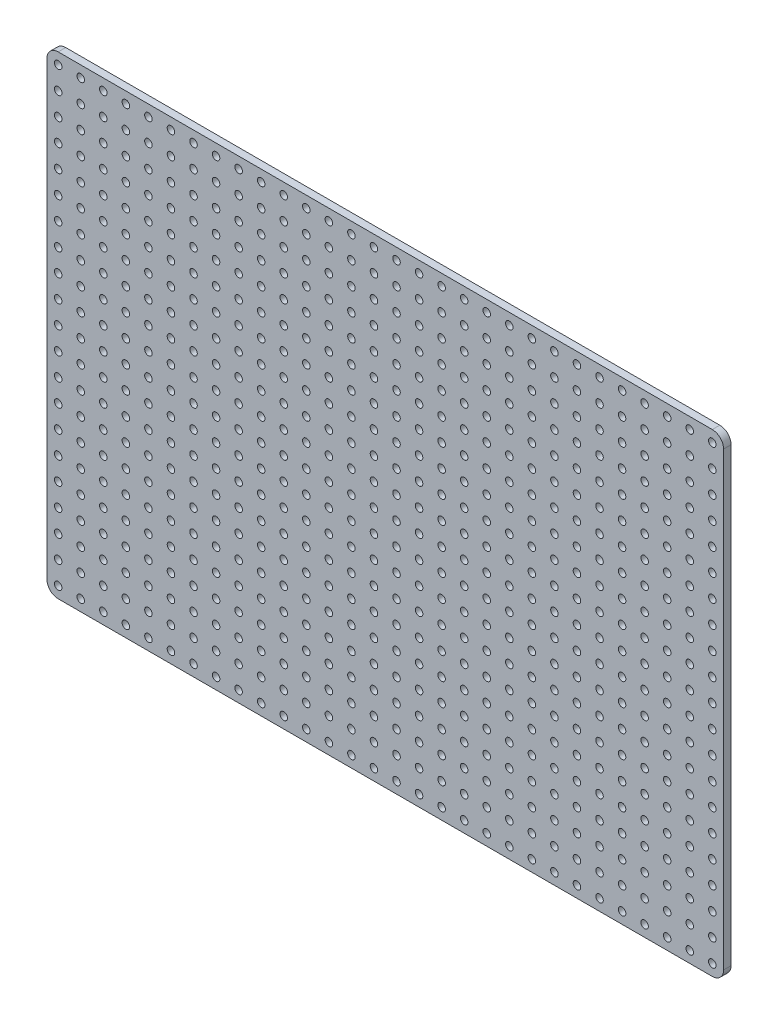
from build123d import *

# Parameters (mm, degrees)
MODEL_R                 = 1.5
SALIENTE_EXTRUIR1_DEPTH = 3


with BuildPart() as part:
    # Model → Saliente-Extruir1 (new body)
    with BuildSketch(Plane.XY):
        with BuildLine():
            Line((256.429131311, 489.742243614), (517.429131311, 489.742243614))
            ThreePointArc((517.429131311, 489.742243614), (520.611111826, 488.424224129), (521.929131311, 485.242243614))
            Line((521.929131311, 485.242243614), (521.929131311, 305.242243614))
            ThreePointArc((521.929131311, 305.242243614), (520.611111826, 302.060263099), (517.429131311, 300.742243614))
            Line((517.429131311, 300.742243614), (256.429131311, 300.742243614))
            ThreePointArc((256.429131311, 300.742243614), (253.247150795, 302.060263099), (251.929131311, 305.242243614))
            Line((251.929131311, 305.242243614), (251.929131311, 485.242243614))
            ThreePointArc((251.929131311, 485.242243614), (253.247150795, 488.424224129), (256.429131311, 489.742243614))
        make_face()
        with Locations((256.429131311, 485.242243614)):
            Circle(MODEL_R, mode=Mode.SUBTRACT)
        with Locations((256.429131311, 476.242243614)):
            Circle(MODEL_R, mode=Mode.SUBTRACT)
        with Locations((256.429131311, 467.242243614)):
            Circle(MODEL_R, mode=Mode.SUBTRACT)
        with Locations((256.429131311, 458.242243614)):
            Circle(MODEL_R, mode=Mode.SUBTRACT)
        with Locations((256.429131311, 449.242243614)):
            Circle(MODEL_R, mode=Mode.SUBTRACT)
        with Locations((256.429131311, 440.242243614)):
            Circle(MODEL_R, mode=Mode.SUBTRACT)
        with Locations((256.429131311, 431.242243614)):
            Circle(MODEL_R, mode=Mode.SUBTRACT)
        with Locations((256.429131311, 422.242243614)):
            Circle(MODEL_R, mode=Mode.SUBTRACT)
        with Locations((256.429131311, 413.242243614)):
            Circle(MODEL_R, mode=Mode.SUBTRACT)
        with Locations((256.429131311, 404.242243614)):
            Circle(MODEL_R, mode=Mode.SUBTRACT)
        with Locations((256.429131311, 395.242243614)):
            Circle(MODEL_R, mode=Mode.SUBTRACT)
        with Locations((256.429131311, 386.242243614)):
            Circle(MODEL_R, mode=Mode.SUBTRACT)
        with Locations((256.429131311, 377.242243614)):
            Circle(MODEL_R, mode=Mode.SUBTRACT)
        with Locations((256.429131311, 368.242243614)):
            Circle(MODEL_R, mode=Mode.SUBTRACT)
        with Locations((256.429131311, 359.242243614)):
            Circle(MODEL_R, mode=Mode.SUBTRACT)
        with Locations((256.429131311, 350.242243614)):
            Circle(MODEL_R, mode=Mode.SUBTRACT)
        with Locations((256.429131311, 341.242243614)):
            Circle(MODEL_R, mode=Mode.SUBTRACT)
        with Locations((256.429131311, 332.242243614)):
            Circle(MODEL_R, mode=Mode.SUBTRACT)
        with Locations((256.429131311, 323.242243614)):
            Circle(MODEL_R, mode=Mode.SUBTRACT)
        with Locations((256.429131311, 314.242243614)):
            Circle(MODEL_R, mode=Mode.SUBTRACT)
        with Locations((256.429131311, 305.242243614)):
            Circle(MODEL_R, mode=Mode.SUBTRACT)
        with Locations((265.429131311, 485.242243614)):
            Circle(MODEL_R, mode=Mode.SUBTRACT)
        with Locations((265.429131311, 476.242243614)):
            Circle(MODEL_R, mode=Mode.SUBTRACT)
        with Locations((265.429131311, 467.242243614)):
            Circle(MODEL_R, mode=Mode.SUBTRACT)
        with Locations((265.429131311, 458.242243614)):
            Circle(MODEL_R, mode=Mode.SUBTRACT)
        with Locations((265.429131311, 449.242243614)):
            Circle(MODEL_R, mode=Mode.SUBTRACT)
        with Locations((265.429131311, 440.242243614)):
            Circle(MODEL_R, mode=Mode.SUBTRACT)
        with Locations((265.429131311, 431.242243614)):
            Circle(MODEL_R, mode=Mode.SUBTRACT)
        with Locations((265.429131311, 422.242243614)):
            Circle(MODEL_R, mode=Mode.SUBTRACT)
        with Locations((265.429131311, 413.242243614)):
            Circle(MODEL_R, mode=Mode.SUBTRACT)
        with Locations((265.429131311, 404.242243614)):
            Circle(MODEL_R, mode=Mode.SUBTRACT)
        with Locations((265.429131311, 395.242243614)):
            Circle(MODEL_R, mode=Mode.SUBTRACT)
        with Locations((265.429131311, 386.242243614)):
            Circle(MODEL_R, mode=Mode.SUBTRACT)
        with Locations((265.429131311, 377.242243614)):
            Circle(MODEL_R, mode=Mode.SUBTRACT)
        with Locations((265.429131311, 368.242243614)):
            Circle(MODEL_R, mode=Mode.SUBTRACT)
        with Locations((265.429131311, 359.242243614)):
            Circle(MODEL_R, mode=Mode.SUBTRACT)
        with Locations((265.429131311, 350.242243614)):
            Circle(MODEL_R, mode=Mode.SUBTRACT)
        with Locations((265.429131311, 341.242243614)):
            Circle(MODEL_R, mode=Mode.SUBTRACT)
        with Locations((265.429131311, 332.242243614)):
            Circle(MODEL_R, mode=Mode.SUBTRACT)
        with Locations((265.429131311, 323.242243614)):
            Circle(MODEL_R, mode=Mode.SUBTRACT)
        with Locations((265.429131311, 314.242243614)):
            Circle(MODEL_R, mode=Mode.SUBTRACT)
        with Locations((265.429131311, 305.242243614)):
            Circle(MODEL_R, mode=Mode.SUBTRACT)
        with Locations((274.429131311, 485.242243614)):
            Circle(MODEL_R, mode=Mode.SUBTRACT)
        with Locations((274.429131311, 476.242243614)):
            Circle(MODEL_R, mode=Mode.SUBTRACT)
        with Locations((274.429131311, 467.242243614)):
            Circle(MODEL_R, mode=Mode.SUBTRACT)
        with Locations((274.429131311, 458.242243614)):
            Circle(MODEL_R, mode=Mode.SUBTRACT)
        with Locations((274.429131311, 449.242243614)):
            Circle(MODEL_R, mode=Mode.SUBTRACT)
        with Locations((274.429131311, 440.242243614)):
            Circle(MODEL_R, mode=Mode.SUBTRACT)
        with Locations((274.429131311, 431.242243614)):
            Circle(MODEL_R, mode=Mode.SUBTRACT)
        with Locations((274.429131311, 422.242243614)):
            Circle(MODEL_R, mode=Mode.SUBTRACT)
        with Locations((274.429131311, 413.242243614)):
            Circle(MODEL_R, mode=Mode.SUBTRACT)
        with Locations((274.429131311, 404.242243614)):
            Circle(MODEL_R, mode=Mode.SUBTRACT)
        with Locations((274.429131311, 395.242243614)):
            Circle(MODEL_R, mode=Mode.SUBTRACT)
        with Locations((274.429131311, 386.242243614)):
            Circle(MODEL_R, mode=Mode.SUBTRACT)
        with Locations((274.429131311, 377.242243614)):
            Circle(MODEL_R, mode=Mode.SUBTRACT)
        with Locations((274.429131311, 368.242243614)):
            Circle(MODEL_R, mode=Mode.SUBTRACT)
        with Locations((274.429131311, 359.242243614)):
            Circle(MODEL_R, mode=Mode.SUBTRACT)
        with Locations((274.429131311, 350.242243614)):
            Circle(MODEL_R, mode=Mode.SUBTRACT)
        with Locations((274.429131311, 341.242243614)):
            Circle(MODEL_R, mode=Mode.SUBTRACT)
        with Locations((274.429131311, 332.242243614)):
            Circle(MODEL_R, mode=Mode.SUBTRACT)
        with Locations((274.429131311, 323.242243614)):
            Circle(MODEL_R, mode=Mode.SUBTRACT)
        with Locations((274.429131311, 314.242243614)):
            Circle(MODEL_R, mode=Mode.SUBTRACT)
        with Locations((274.429131311, 305.242243614)):
            Circle(MODEL_R, mode=Mode.SUBTRACT)
        with Locations((283.429131311, 485.242243614)):
            Circle(MODEL_R, mode=Mode.SUBTRACT)
        with Locations((283.429131311, 476.242243614)):
            Circle(MODEL_R, mode=Mode.SUBTRACT)
        with Locations((283.429131311, 467.242243614)):
            Circle(MODEL_R, mode=Mode.SUBTRACT)
        with Locations((283.429131311, 458.242243614)):
            Circle(MODEL_R, mode=Mode.SUBTRACT)
        with Locations((283.429131311, 449.242243614)):
            Circle(MODEL_R, mode=Mode.SUBTRACT)
        with Locations((283.429131311, 440.242243614)):
            Circle(MODEL_R, mode=Mode.SUBTRACT)
        with Locations((283.429131311, 431.242243614)):
            Circle(MODEL_R, mode=Mode.SUBTRACT)
        with Locations((283.429131311, 422.242243614)):
            Circle(MODEL_R, mode=Mode.SUBTRACT)
        with Locations((283.429131311, 413.242243614)):
            Circle(MODEL_R, mode=Mode.SUBTRACT)
        with Locations((283.429131311, 404.242243614)):
            Circle(MODEL_R, mode=Mode.SUBTRACT)
        with Locations((283.429131311, 395.242243614)):
            Circle(MODEL_R, mode=Mode.SUBTRACT)
        with Locations((283.429131311, 386.242243614)):
            Circle(MODEL_R, mode=Mode.SUBTRACT)
        with Locations((283.429131311, 377.242243614)):
            Circle(MODEL_R, mode=Mode.SUBTRACT)
        with Locations((283.429131311, 368.242243614)):
            Circle(MODEL_R, mode=Mode.SUBTRACT)
        with Locations((283.429131311, 359.242243614)):
            Circle(MODEL_R, mode=Mode.SUBTRACT)
        with Locations((283.429131311, 350.242243614)):
            Circle(MODEL_R, mode=Mode.SUBTRACT)
        with Locations((283.429131311, 341.242243614)):
            Circle(MODEL_R, mode=Mode.SUBTRACT)
        with Locations((283.429131311, 332.242243614)):
            Circle(MODEL_R, mode=Mode.SUBTRACT)
        with Locations((283.429131311, 323.242243614)):
            Circle(MODEL_R, mode=Mode.SUBTRACT)
        with Locations((283.429131311, 314.242243614)):
            Circle(MODEL_R, mode=Mode.SUBTRACT)
        with Locations((283.429131311, 305.242243614)):
            Circle(MODEL_R, mode=Mode.SUBTRACT)
        with Locations((292.429131311, 485.242243614)):
            Circle(MODEL_R, mode=Mode.SUBTRACT)
        with Locations((292.429131311, 476.242243614)):
            Circle(MODEL_R, mode=Mode.SUBTRACT)
        with Locations((292.429131311, 467.242243614)):
            Circle(MODEL_R, mode=Mode.SUBTRACT)
        with Locations((292.429131311, 458.242243614)):
            Circle(MODEL_R, mode=Mode.SUBTRACT)
        with Locations((292.429131311, 449.242243614)):
            Circle(MODEL_R, mode=Mode.SUBTRACT)
        with Locations((292.429131311, 440.242243614)):
            Circle(MODEL_R, mode=Mode.SUBTRACT)
        with Locations((292.429131311, 431.242243614)):
            Circle(MODEL_R, mode=Mode.SUBTRACT)
        with Locations((292.429131311, 422.242243614)):
            Circle(MODEL_R, mode=Mode.SUBTRACT)
        with Locations((292.429131311, 413.242243614)):
            Circle(MODEL_R, mode=Mode.SUBTRACT)
        with Locations((292.429131311, 404.242243614)):
            Circle(MODEL_R, mode=Mode.SUBTRACT)
        with Locations((292.429131311, 395.242243614)):
            Circle(MODEL_R, mode=Mode.SUBTRACT)
        with Locations((292.429131311, 386.242243614)):
            Circle(MODEL_R, mode=Mode.SUBTRACT)
        with Locations((292.429131311, 377.242243614)):
            Circle(MODEL_R, mode=Mode.SUBTRACT)
        with Locations((292.429131311, 368.242243614)):
            Circle(MODEL_R, mode=Mode.SUBTRACT)
        with Locations((292.429131311, 359.242243614)):
            Circle(MODEL_R, mode=Mode.SUBTRACT)
        with Locations((292.429131311, 350.242243614)):
            Circle(MODEL_R, mode=Mode.SUBTRACT)
        with Locations((292.429131311, 341.242243614)):
            Circle(MODEL_R, mode=Mode.SUBTRACT)
        with Locations((292.429131311, 332.242243614)):
            Circle(MODEL_R, mode=Mode.SUBTRACT)
        with Locations((292.429131311, 323.242243614)):
            Circle(MODEL_R, mode=Mode.SUBTRACT)
        with Locations((292.429131311, 314.242243614)):
            Circle(MODEL_R, mode=Mode.SUBTRACT)
        with Locations((292.429131311, 305.242243614)):
            Circle(MODEL_R, mode=Mode.SUBTRACT)
        with Locations((301.429131311, 485.242243614)):
            Circle(MODEL_R, mode=Mode.SUBTRACT)
        with Locations((301.429131311, 476.242243614)):
            Circle(MODEL_R, mode=Mode.SUBTRACT)
        with Locations((301.429131311, 467.242243614)):
            Circle(MODEL_R, mode=Mode.SUBTRACT)
        with Locations((301.429131311, 458.242243614)):
            Circle(MODEL_R, mode=Mode.SUBTRACT)
        with Locations((301.429131311, 449.242243614)):
            Circle(MODEL_R, mode=Mode.SUBTRACT)
        with Locations((301.429131311, 440.242243614)):
            Circle(MODEL_R, mode=Mode.SUBTRACT)
        with Locations((301.429131311, 431.242243614)):
            Circle(MODEL_R, mode=Mode.SUBTRACT)
        with Locations((301.429131311, 422.242243614)):
            Circle(MODEL_R, mode=Mode.SUBTRACT)
        with Locations((301.429131311, 413.242243614)):
            Circle(MODEL_R, mode=Mode.SUBTRACT)
        with Locations((301.429131311, 404.242243614)):
            Circle(MODEL_R, mode=Mode.SUBTRACT)
        with Locations((301.429131311, 395.242243614)):
            Circle(MODEL_R, mode=Mode.SUBTRACT)
        with Locations((301.429131311, 386.242243614)):
            Circle(MODEL_R, mode=Mode.SUBTRACT)
        with Locations((301.429131311, 377.242243614)):
            Circle(MODEL_R, mode=Mode.SUBTRACT)
        with Locations((301.429131311, 368.242243614)):
            Circle(MODEL_R, mode=Mode.SUBTRACT)
        with Locations((301.429131311, 359.242243614)):
            Circle(MODEL_R, mode=Mode.SUBTRACT)
        with Locations((301.429131311, 350.242243614)):
            Circle(MODEL_R, mode=Mode.SUBTRACT)
        with Locations((301.429131311, 341.242243614)):
            Circle(MODEL_R, mode=Mode.SUBTRACT)
        with Locations((301.429131311, 332.242243614)):
            Circle(MODEL_R, mode=Mode.SUBTRACT)
        with Locations((301.429131311, 323.242243614)):
            Circle(MODEL_R, mode=Mode.SUBTRACT)
        with Locations((301.429131311, 314.242243614)):
            Circle(MODEL_R, mode=Mode.SUBTRACT)
        with Locations((301.429131311, 305.242243614)):
            Circle(MODEL_R, mode=Mode.SUBTRACT)
        with Locations((310.429131311, 485.242243614)):
            Circle(MODEL_R, mode=Mode.SUBTRACT)
        with Locations((310.429131311, 476.242243614)):
            Circle(MODEL_R, mode=Mode.SUBTRACT)
        with Locations((310.429131311, 467.242243614)):
            Circle(MODEL_R, mode=Mode.SUBTRACT)
        with Locations((310.429131311, 458.242243614)):
            Circle(MODEL_R, mode=Mode.SUBTRACT)
        with Locations((310.429131311, 449.242243614)):
            Circle(MODEL_R, mode=Mode.SUBTRACT)
        with Locations((310.429131311, 440.242243614)):
            Circle(MODEL_R, mode=Mode.SUBTRACT)
        with Locations((310.429131311, 431.242243614)):
            Circle(MODEL_R, mode=Mode.SUBTRACT)
        with Locations((310.429131311, 422.242243614)):
            Circle(MODEL_R, mode=Mode.SUBTRACT)
        with Locations((310.429131311, 413.242243614)):
            Circle(MODEL_R, mode=Mode.SUBTRACT)
        with Locations((310.429131311, 404.242243614)):
            Circle(MODEL_R, mode=Mode.SUBTRACT)
        with Locations((310.429131311, 395.242243614)):
            Circle(MODEL_R, mode=Mode.SUBTRACT)
        with Locations((310.429131311, 386.242243614)):
            Circle(MODEL_R, mode=Mode.SUBTRACT)
        with Locations((310.429131311, 377.242243614)):
            Circle(MODEL_R, mode=Mode.SUBTRACT)
        with Locations((310.429131311, 368.242243614)):
            Circle(MODEL_R, mode=Mode.SUBTRACT)
        with Locations((310.429131311, 359.242243614)):
            Circle(MODEL_R, mode=Mode.SUBTRACT)
        with Locations((310.429131311, 350.242243614)):
            Circle(MODEL_R, mode=Mode.SUBTRACT)
        with Locations((310.429131311, 341.242243614)):
            Circle(MODEL_R, mode=Mode.SUBTRACT)
        with Locations((310.429131311, 332.242243614)):
            Circle(MODEL_R, mode=Mode.SUBTRACT)
        with Locations((310.429131311, 323.242243614)):
            Circle(MODEL_R, mode=Mode.SUBTRACT)
        with Locations((310.429131311, 314.242243614)):
            Circle(MODEL_R, mode=Mode.SUBTRACT)
        with Locations((310.429131311, 305.242243614)):
            Circle(MODEL_R, mode=Mode.SUBTRACT)
        with Locations((319.429131311, 485.242243614)):
            Circle(MODEL_R, mode=Mode.SUBTRACT)
        with Locations((319.429131311, 476.242243614)):
            Circle(MODEL_R, mode=Mode.SUBTRACT)
        with Locations((319.429131311, 467.242243614)):
            Circle(MODEL_R, mode=Mode.SUBTRACT)
        with Locations((319.429131311, 458.242243614)):
            Circle(MODEL_R, mode=Mode.SUBTRACT)
        with Locations((319.429131311, 449.242243614)):
            Circle(MODEL_R, mode=Mode.SUBTRACT)
        with Locations((319.429131311, 440.242243614)):
            Circle(MODEL_R, mode=Mode.SUBTRACT)
        with Locations((319.429131311, 431.242243614)):
            Circle(MODEL_R, mode=Mode.SUBTRACT)
        with Locations((319.429131311, 422.242243614)):
            Circle(MODEL_R, mode=Mode.SUBTRACT)
        with Locations((319.429131311, 413.242243614)):
            Circle(MODEL_R, mode=Mode.SUBTRACT)
        with Locations((319.429131311, 404.242243614)):
            Circle(MODEL_R, mode=Mode.SUBTRACT)
        with Locations((319.429131311, 395.242243614)):
            Circle(MODEL_R, mode=Mode.SUBTRACT)
        with Locations((319.429131311, 386.242243614)):
            Circle(MODEL_R, mode=Mode.SUBTRACT)
        with Locations((319.429131311, 377.242243614)):
            Circle(MODEL_R, mode=Mode.SUBTRACT)
        with Locations((319.429131311, 368.242243614)):
            Circle(MODEL_R, mode=Mode.SUBTRACT)
        with Locations((319.429131311, 359.242243614)):
            Circle(MODEL_R, mode=Mode.SUBTRACT)
        with Locations((319.429131311, 350.242243614)):
            Circle(MODEL_R, mode=Mode.SUBTRACT)
        with Locations((319.429131311, 341.242243614)):
            Circle(MODEL_R, mode=Mode.SUBTRACT)
        with Locations((319.429131311, 332.242243614)):
            Circle(MODEL_R, mode=Mode.SUBTRACT)
        with Locations((319.429131311, 323.242243614)):
            Circle(MODEL_R, mode=Mode.SUBTRACT)
        with Locations((319.429131311, 314.242243614)):
            Circle(MODEL_R, mode=Mode.SUBTRACT)
        with Locations((319.429131311, 305.242243614)):
            Circle(MODEL_R, mode=Mode.SUBTRACT)
        with Locations((328.429131311, 485.242243614)):
            Circle(MODEL_R, mode=Mode.SUBTRACT)
        with Locations((328.429131311, 476.242243614)):
            Circle(MODEL_R, mode=Mode.SUBTRACT)
        with Locations((328.429131311, 467.242243614)):
            Circle(MODEL_R, mode=Mode.SUBTRACT)
        with Locations((328.429131311, 458.242243614)):
            Circle(MODEL_R, mode=Mode.SUBTRACT)
        with Locations((328.429131311, 449.242243614)):
            Circle(MODEL_R, mode=Mode.SUBTRACT)
        with Locations((328.429131311, 440.242243614)):
            Circle(MODEL_R, mode=Mode.SUBTRACT)
        with Locations((328.429131311, 431.242243614)):
            Circle(MODEL_R, mode=Mode.SUBTRACT)
        with Locations((328.429131311, 422.242243614)):
            Circle(MODEL_R, mode=Mode.SUBTRACT)
        with Locations((328.429131311, 413.242243614)):
            Circle(MODEL_R, mode=Mode.SUBTRACT)
        with Locations((328.429131311, 404.242243614)):
            Circle(MODEL_R, mode=Mode.SUBTRACT)
        with Locations((328.429131311, 395.242243614)):
            Circle(MODEL_R, mode=Mode.SUBTRACT)
        with Locations((328.429131311, 386.242243614)):
            Circle(MODEL_R, mode=Mode.SUBTRACT)
        with Locations((328.429131311, 377.242243614)):
            Circle(MODEL_R, mode=Mode.SUBTRACT)
        with Locations((328.429131311, 368.242243614)):
            Circle(MODEL_R, mode=Mode.SUBTRACT)
        with Locations((328.429131311, 359.242243614)):
            Circle(MODEL_R, mode=Mode.SUBTRACT)
        with Locations((328.429131311, 350.242243614)):
            Circle(MODEL_R, mode=Mode.SUBTRACT)
        with Locations((328.429131311, 341.242243614)):
            Circle(MODEL_R, mode=Mode.SUBTRACT)
        with Locations((328.429131311, 332.242243614)):
            Circle(MODEL_R, mode=Mode.SUBTRACT)
        with Locations((328.429131311, 323.242243614)):
            Circle(MODEL_R, mode=Mode.SUBTRACT)
        with Locations((328.429131311, 314.242243614)):
            Circle(MODEL_R, mode=Mode.SUBTRACT)
        with Locations((328.429131311, 305.242243614)):
            Circle(MODEL_R, mode=Mode.SUBTRACT)
        with Locations((337.429131311, 485.242243614)):
            Circle(MODEL_R, mode=Mode.SUBTRACT)
        with Locations((337.429131311, 476.242243614)):
            Circle(MODEL_R, mode=Mode.SUBTRACT)
        with Locations((337.429131311, 467.242243614)):
            Circle(MODEL_R, mode=Mode.SUBTRACT)
        with Locations((337.429131311, 458.242243614)):
            Circle(MODEL_R, mode=Mode.SUBTRACT)
        with Locations((337.429131311, 449.242243614)):
            Circle(MODEL_R, mode=Mode.SUBTRACT)
        with Locations((337.429131311, 440.242243614)):
            Circle(MODEL_R, mode=Mode.SUBTRACT)
        with Locations((337.429131311, 431.242243614)):
            Circle(MODEL_R, mode=Mode.SUBTRACT)
        with Locations((337.429131311, 422.242243614)):
            Circle(MODEL_R, mode=Mode.SUBTRACT)
        with Locations((337.429131311, 413.242243614)):
            Circle(MODEL_R, mode=Mode.SUBTRACT)
        with Locations((337.429131311, 404.242243614)):
            Circle(MODEL_R, mode=Mode.SUBTRACT)
        with Locations((337.429131311, 395.242243614)):
            Circle(MODEL_R, mode=Mode.SUBTRACT)
        with Locations((337.429131311, 386.242243614)):
            Circle(MODEL_R, mode=Mode.SUBTRACT)
        with Locations((337.429131311, 377.242243614)):
            Circle(MODEL_R, mode=Mode.SUBTRACT)
        with Locations((337.429131311, 368.242243614)):
            Circle(MODEL_R, mode=Mode.SUBTRACT)
        with Locations((337.429131311, 359.242243614)):
            Circle(MODEL_R, mode=Mode.SUBTRACT)
        with Locations((337.429131311, 350.242243614)):
            Circle(MODEL_R, mode=Mode.SUBTRACT)
        with Locations((337.429131311, 341.242243614)):
            Circle(MODEL_R, mode=Mode.SUBTRACT)
        with Locations((337.429131311, 332.242243614)):
            Circle(MODEL_R, mode=Mode.SUBTRACT)
        with Locations((337.429131311, 323.242243614)):
            Circle(MODEL_R, mode=Mode.SUBTRACT)
        with Locations((337.429131311, 314.242243614)):
            Circle(MODEL_R, mode=Mode.SUBTRACT)
        with Locations((337.429131311, 305.242243614)):
            Circle(MODEL_R, mode=Mode.SUBTRACT)
        with Locations((346.429131311, 485.242243614)):
            Circle(MODEL_R, mode=Mode.SUBTRACT)
        with Locations((346.429131311, 476.242243614)):
            Circle(MODEL_R, mode=Mode.SUBTRACT)
        with Locations((346.429131311, 467.242243614)):
            Circle(MODEL_R, mode=Mode.SUBTRACT)
        with Locations((346.429131311, 458.242243614)):
            Circle(MODEL_R, mode=Mode.SUBTRACT)
        with Locations((346.429131311, 449.242243614)):
            Circle(MODEL_R, mode=Mode.SUBTRACT)
        with Locations((346.429131311, 440.242243614)):
            Circle(MODEL_R, mode=Mode.SUBTRACT)
        with Locations((346.429131311, 431.242243614)):
            Circle(MODEL_R, mode=Mode.SUBTRACT)
        with Locations((346.429131311, 422.242243614)):
            Circle(MODEL_R, mode=Mode.SUBTRACT)
        with Locations((346.429131311, 413.242243614)):
            Circle(MODEL_R, mode=Mode.SUBTRACT)
        with Locations((346.429131311, 404.242243614)):
            Circle(MODEL_R, mode=Mode.SUBTRACT)
        with Locations((346.429131311, 395.242243614)):
            Circle(MODEL_R, mode=Mode.SUBTRACT)
        with Locations((346.429131311, 386.242243614)):
            Circle(MODEL_R, mode=Mode.SUBTRACT)
        with Locations((346.429131311, 377.242243614)):
            Circle(MODEL_R, mode=Mode.SUBTRACT)
        with Locations((346.429131311, 368.242243614)):
            Circle(MODEL_R, mode=Mode.SUBTRACT)
        with Locations((346.429131311, 359.242243614)):
            Circle(MODEL_R, mode=Mode.SUBTRACT)
        with Locations((346.429131311, 350.242243614)):
            Circle(MODEL_R, mode=Mode.SUBTRACT)
        with Locations((346.429131311, 341.242243614)):
            Circle(MODEL_R, mode=Mode.SUBTRACT)
        with Locations((346.429131311, 332.242243614)):
            Circle(MODEL_R, mode=Mode.SUBTRACT)
        with Locations((346.429131311, 323.242243614)):
            Circle(MODEL_R, mode=Mode.SUBTRACT)
        with Locations((346.429131311, 314.242243614)):
            Circle(MODEL_R, mode=Mode.SUBTRACT)
        with Locations((346.429131311, 305.242243614)):
            Circle(MODEL_R, mode=Mode.SUBTRACT)
        with Locations((355.429131311, 485.242243614)):
            Circle(MODEL_R, mode=Mode.SUBTRACT)
        with Locations((355.429131311, 476.242243614)):
            Circle(MODEL_R, mode=Mode.SUBTRACT)
        with Locations((355.429131311, 467.242243614)):
            Circle(MODEL_R, mode=Mode.SUBTRACT)
        with Locations((355.429131311, 458.242243614)):
            Circle(MODEL_R, mode=Mode.SUBTRACT)
        with Locations((355.429131311, 449.242243614)):
            Circle(MODEL_R, mode=Mode.SUBTRACT)
        with Locations((355.429131311, 440.242243614)):
            Circle(MODEL_R, mode=Mode.SUBTRACT)
        with Locations((355.429131311, 431.242243614)):
            Circle(MODEL_R, mode=Mode.SUBTRACT)
        with Locations((355.429131311, 422.242243614)):
            Circle(MODEL_R, mode=Mode.SUBTRACT)
        with Locations((355.429131311, 413.242243614)):
            Circle(MODEL_R, mode=Mode.SUBTRACT)
        with Locations((355.429131311, 404.242243614)):
            Circle(MODEL_R, mode=Mode.SUBTRACT)
        with Locations((355.429131311, 395.242243614)):
            Circle(MODEL_R, mode=Mode.SUBTRACT)
        with Locations((355.429131311, 386.242243614)):
            Circle(MODEL_R, mode=Mode.SUBTRACT)
        with Locations((355.429131311, 377.242243614)):
            Circle(MODEL_R, mode=Mode.SUBTRACT)
        with Locations((355.429131311, 368.242243614)):
            Circle(MODEL_R, mode=Mode.SUBTRACT)
        with Locations((355.429131311, 359.242243614)):
            Circle(MODEL_R, mode=Mode.SUBTRACT)
        with Locations((355.429131311, 350.242243614)):
            Circle(MODEL_R, mode=Mode.SUBTRACT)
        with Locations((355.429131311, 341.242243614)):
            Circle(MODEL_R, mode=Mode.SUBTRACT)
        with Locations((355.429131311, 332.242243614)):
            Circle(MODEL_R, mode=Mode.SUBTRACT)
        with Locations((355.429131311, 323.242243614)):
            Circle(MODEL_R, mode=Mode.SUBTRACT)
        with Locations((355.429131311, 314.242243614)):
            Circle(MODEL_R, mode=Mode.SUBTRACT)
        with Locations((355.429131311, 305.242243614)):
            Circle(MODEL_R, mode=Mode.SUBTRACT)
        with Locations((364.429131311, 485.242243614)):
            Circle(MODEL_R, mode=Mode.SUBTRACT)
        with Locations((364.429131311, 476.242243614)):
            Circle(MODEL_R, mode=Mode.SUBTRACT)
        with Locations((364.429131311, 467.242243614)):
            Circle(MODEL_R, mode=Mode.SUBTRACT)
        with Locations((364.429131311, 458.242243614)):
            Circle(MODEL_R, mode=Mode.SUBTRACT)
        with Locations((364.429131311, 449.242243614)):
            Circle(MODEL_R, mode=Mode.SUBTRACT)
        with Locations((364.429131311, 440.242243614)):
            Circle(MODEL_R, mode=Mode.SUBTRACT)
        with Locations((364.429131311, 431.242243614)):
            Circle(MODEL_R, mode=Mode.SUBTRACT)
        with Locations((364.429131311, 422.242243614)):
            Circle(MODEL_R, mode=Mode.SUBTRACT)
        with Locations((364.429131311, 413.242243614)):
            Circle(MODEL_R, mode=Mode.SUBTRACT)
        with Locations((364.429131311, 404.242243614)):
            Circle(MODEL_R, mode=Mode.SUBTRACT)
        with Locations((364.429131311, 395.242243614)):
            Circle(MODEL_R, mode=Mode.SUBTRACT)
        with Locations((364.429131311, 386.242243614)):
            Circle(MODEL_R, mode=Mode.SUBTRACT)
        with Locations((364.429131311, 377.242243614)):
            Circle(MODEL_R, mode=Mode.SUBTRACT)
        with Locations((364.429131311, 368.242243614)):
            Circle(MODEL_R, mode=Mode.SUBTRACT)
        with Locations((364.429131311, 359.242243614)):
            Circle(MODEL_R, mode=Mode.SUBTRACT)
        with Locations((364.429131311, 350.242243614)):
            Circle(MODEL_R, mode=Mode.SUBTRACT)
        with Locations((364.429131311, 341.242243614)):
            Circle(MODEL_R, mode=Mode.SUBTRACT)
        with Locations((364.429131311, 332.242243614)):
            Circle(MODEL_R, mode=Mode.SUBTRACT)
        with Locations((364.429131311, 323.242243614)):
            Circle(MODEL_R, mode=Mode.SUBTRACT)
        with Locations((364.429131311, 314.242243614)):
            Circle(MODEL_R, mode=Mode.SUBTRACT)
        with Locations((364.429131311, 305.242243614)):
            Circle(MODEL_R, mode=Mode.SUBTRACT)
        with Locations((373.429131311, 485.242243614)):
            Circle(MODEL_R, mode=Mode.SUBTRACT)
        with Locations((373.429131311, 476.242243614)):
            Circle(MODEL_R, mode=Mode.SUBTRACT)
        with Locations((373.429131311, 467.242243614)):
            Circle(MODEL_R, mode=Mode.SUBTRACT)
        with Locations((373.429131311, 458.242243614)):
            Circle(MODEL_R, mode=Mode.SUBTRACT)
        with Locations((373.429131311, 449.242243614)):
            Circle(MODEL_R, mode=Mode.SUBTRACT)
        with Locations((373.429131311, 440.242243614)):
            Circle(MODEL_R, mode=Mode.SUBTRACT)
        with Locations((373.429131311, 431.242243614)):
            Circle(MODEL_R, mode=Mode.SUBTRACT)
        with Locations((373.429131311, 422.242243614)):
            Circle(MODEL_R, mode=Mode.SUBTRACT)
        with Locations((373.429131311, 413.242243614)):
            Circle(MODEL_R, mode=Mode.SUBTRACT)
        with Locations((373.429131311, 404.242243614)):
            Circle(MODEL_R, mode=Mode.SUBTRACT)
        with Locations((373.429131311, 395.242243614)):
            Circle(MODEL_R, mode=Mode.SUBTRACT)
        with Locations((373.429131311, 386.242243614)):
            Circle(MODEL_R, mode=Mode.SUBTRACT)
        with Locations((373.429131311, 377.242243614)):
            Circle(MODEL_R, mode=Mode.SUBTRACT)
        with Locations((373.429131311, 368.242243614)):
            Circle(MODEL_R, mode=Mode.SUBTRACT)
        with Locations((373.429131311, 359.242243614)):
            Circle(MODEL_R, mode=Mode.SUBTRACT)
        with Locations((373.429131311, 350.242243614)):
            Circle(MODEL_R, mode=Mode.SUBTRACT)
        with Locations((373.429131311, 341.242243614)):
            Circle(MODEL_R, mode=Mode.SUBTRACT)
        with Locations((373.429131311, 332.242243614)):
            Circle(MODEL_R, mode=Mode.SUBTRACT)
        with Locations((373.429131311, 323.242243614)):
            Circle(MODEL_R, mode=Mode.SUBTRACT)
        with Locations((373.429131311, 314.242243614)):
            Circle(MODEL_R, mode=Mode.SUBTRACT)
        with Locations((373.429131311, 305.242243614)):
            Circle(MODEL_R, mode=Mode.SUBTRACT)
        with Locations((382.429131311, 485.242243614)):
            Circle(MODEL_R, mode=Mode.SUBTRACT)
        with Locations((382.429131311, 476.242243614)):
            Circle(MODEL_R, mode=Mode.SUBTRACT)
        with Locations((382.429131311, 467.242243614)):
            Circle(MODEL_R, mode=Mode.SUBTRACT)
        with Locations((382.429131311, 458.242243614)):
            Circle(MODEL_R, mode=Mode.SUBTRACT)
        with Locations((382.429131311, 449.242243614)):
            Circle(MODEL_R, mode=Mode.SUBTRACT)
        with Locations((382.429131311, 440.242243614)):
            Circle(MODEL_R, mode=Mode.SUBTRACT)
        with Locations((382.429131311, 431.242243614)):
            Circle(MODEL_R, mode=Mode.SUBTRACT)
        with Locations((382.429131311, 422.242243614)):
            Circle(MODEL_R, mode=Mode.SUBTRACT)
        with Locations((382.429131311, 413.242243614)):
            Circle(MODEL_R, mode=Mode.SUBTRACT)
        with Locations((382.429131311, 404.242243614)):
            Circle(MODEL_R, mode=Mode.SUBTRACT)
        with Locations((382.429131311, 395.242243614)):
            Circle(MODEL_R, mode=Mode.SUBTRACT)
        with Locations((382.429131311, 386.242243614)):
            Circle(MODEL_R, mode=Mode.SUBTRACT)
        with Locations((382.429131311, 377.242243614)):
            Circle(MODEL_R, mode=Mode.SUBTRACT)
        with Locations((382.429131311, 368.242243614)):
            Circle(MODEL_R, mode=Mode.SUBTRACT)
        with Locations((382.429131311, 359.242243614)):
            Circle(MODEL_R, mode=Mode.SUBTRACT)
        with Locations((382.429131311, 350.242243614)):
            Circle(MODEL_R, mode=Mode.SUBTRACT)
        with Locations((382.429131311, 341.242243614)):
            Circle(MODEL_R, mode=Mode.SUBTRACT)
        with Locations((382.429131311, 332.242243614)):
            Circle(MODEL_R, mode=Mode.SUBTRACT)
        with Locations((382.429131311, 323.242243614)):
            Circle(MODEL_R, mode=Mode.SUBTRACT)
        with Locations((382.429131311, 314.242243614)):
            Circle(MODEL_R, mode=Mode.SUBTRACT)
        with Locations((382.429131311, 305.242243614)):
            Circle(MODEL_R, mode=Mode.SUBTRACT)
        with Locations((391.429131311, 485.242243614)):
            Circle(MODEL_R, mode=Mode.SUBTRACT)
        with Locations((391.429131311, 476.242243614)):
            Circle(MODEL_R, mode=Mode.SUBTRACT)
        with Locations((391.429131311, 467.242243614)):
            Circle(MODEL_R, mode=Mode.SUBTRACT)
        with Locations((391.429131311, 458.242243614)):
            Circle(MODEL_R, mode=Mode.SUBTRACT)
        with Locations((391.429131311, 449.242243614)):
            Circle(MODEL_R, mode=Mode.SUBTRACT)
        with Locations((391.429131311, 440.242243614)):
            Circle(MODEL_R, mode=Mode.SUBTRACT)
        with Locations((391.429131311, 431.242243614)):
            Circle(MODEL_R, mode=Mode.SUBTRACT)
        with Locations((391.429131311, 422.242243614)):
            Circle(MODEL_R, mode=Mode.SUBTRACT)
        with Locations((391.429131311, 413.242243614)):
            Circle(MODEL_R, mode=Mode.SUBTRACT)
        with Locations((391.429131311, 404.242243614)):
            Circle(MODEL_R, mode=Mode.SUBTRACT)
        with Locations((391.429131311, 395.242243614)):
            Circle(MODEL_R, mode=Mode.SUBTRACT)
        with Locations((391.429131311, 386.242243614)):
            Circle(MODEL_R, mode=Mode.SUBTRACT)
        with Locations((391.429131311, 377.242243614)):
            Circle(MODEL_R, mode=Mode.SUBTRACT)
        with Locations((391.429131311, 368.242243614)):
            Circle(MODEL_R, mode=Mode.SUBTRACT)
        with Locations((391.429131311, 359.242243614)):
            Circle(MODEL_R, mode=Mode.SUBTRACT)
        with Locations((391.429131311, 350.242243614)):
            Circle(MODEL_R, mode=Mode.SUBTRACT)
        with Locations((391.429131311, 341.242243614)):
            Circle(MODEL_R, mode=Mode.SUBTRACT)
        with Locations((391.429131311, 332.242243614)):
            Circle(MODEL_R, mode=Mode.SUBTRACT)
        with Locations((391.429131311, 323.242243614)):
            Circle(MODEL_R, mode=Mode.SUBTRACT)
        with Locations((391.429131311, 314.242243614)):
            Circle(MODEL_R, mode=Mode.SUBTRACT)
        with Locations((391.429131311, 305.242243614)):
            Circle(MODEL_R, mode=Mode.SUBTRACT)
        with Locations((400.429131311, 485.242243614)):
            Circle(MODEL_R, mode=Mode.SUBTRACT)
        with Locations((400.429131311, 476.242243614)):
            Circle(MODEL_R, mode=Mode.SUBTRACT)
        with Locations((400.429131311, 467.242243614)):
            Circle(MODEL_R, mode=Mode.SUBTRACT)
        with Locations((400.429131311, 458.242243614)):
            Circle(MODEL_R, mode=Mode.SUBTRACT)
        with Locations((400.429131311, 449.242243614)):
            Circle(MODEL_R, mode=Mode.SUBTRACT)
        with Locations((400.429131311, 440.242243614)):
            Circle(MODEL_R, mode=Mode.SUBTRACT)
        with Locations((400.429131311, 431.242243614)):
            Circle(MODEL_R, mode=Mode.SUBTRACT)
        with Locations((400.429131311, 422.242243614)):
            Circle(MODEL_R, mode=Mode.SUBTRACT)
        with Locations((400.429131311, 413.242243614)):
            Circle(MODEL_R, mode=Mode.SUBTRACT)
        with Locations((400.429131311, 404.242243614)):
            Circle(MODEL_R, mode=Mode.SUBTRACT)
        with Locations((400.429131311, 395.242243614)):
            Circle(MODEL_R, mode=Mode.SUBTRACT)
        with Locations((400.429131311, 386.242243614)):
            Circle(MODEL_R, mode=Mode.SUBTRACT)
        with Locations((400.429131311, 377.242243614)):
            Circle(MODEL_R, mode=Mode.SUBTRACT)
        with Locations((400.429131311, 368.242243614)):
            Circle(MODEL_R, mode=Mode.SUBTRACT)
        with Locations((400.429131311, 359.242243614)):
            Circle(MODEL_R, mode=Mode.SUBTRACT)
        with Locations((400.429131311, 350.242243614)):
            Circle(MODEL_R, mode=Mode.SUBTRACT)
        with Locations((400.429131311, 341.242243614)):
            Circle(MODEL_R, mode=Mode.SUBTRACT)
        with Locations((400.429131311, 332.242243614)):
            Circle(MODEL_R, mode=Mode.SUBTRACT)
        with Locations((400.429131311, 323.242243614)):
            Circle(MODEL_R, mode=Mode.SUBTRACT)
        with Locations((400.429131311, 314.242243614)):
            Circle(MODEL_R, mode=Mode.SUBTRACT)
        with Locations((400.429131311, 305.242243614)):
            Circle(MODEL_R, mode=Mode.SUBTRACT)
        with Locations((409.429131311, 485.242243614)):
            Circle(MODEL_R, mode=Mode.SUBTRACT)
        with Locations((409.429131311, 476.242243614)):
            Circle(MODEL_R, mode=Mode.SUBTRACT)
        with Locations((409.429131311, 467.242243614)):
            Circle(MODEL_R, mode=Mode.SUBTRACT)
        with Locations((409.429131311, 458.242243614)):
            Circle(MODEL_R, mode=Mode.SUBTRACT)
        with Locations((409.429131311, 449.242243614)):
            Circle(MODEL_R, mode=Mode.SUBTRACT)
        with Locations((409.429131311, 440.242243614)):
            Circle(MODEL_R, mode=Mode.SUBTRACT)
        with Locations((409.429131311, 431.242243614)):
            Circle(MODEL_R, mode=Mode.SUBTRACT)
        with Locations((409.429131311, 422.242243614)):
            Circle(MODEL_R, mode=Mode.SUBTRACT)
        with Locations((409.429131311, 413.242243614)):
            Circle(MODEL_R, mode=Mode.SUBTRACT)
        with Locations((409.429131311, 404.242243614)):
            Circle(MODEL_R, mode=Mode.SUBTRACT)
        with Locations((409.429131311, 395.242243614)):
            Circle(MODEL_R, mode=Mode.SUBTRACT)
        with Locations((409.429131311, 386.242243614)):
            Circle(MODEL_R, mode=Mode.SUBTRACT)
        with Locations((409.429131311, 377.242243614)):
            Circle(MODEL_R, mode=Mode.SUBTRACT)
        with Locations((409.429131311, 368.242243614)):
            Circle(MODEL_R, mode=Mode.SUBTRACT)
        with Locations((409.429131311, 359.242243614)):
            Circle(MODEL_R, mode=Mode.SUBTRACT)
        with Locations((409.429131311, 350.242243614)):
            Circle(MODEL_R, mode=Mode.SUBTRACT)
        with Locations((409.429131311, 341.242243614)):
            Circle(MODEL_R, mode=Mode.SUBTRACT)
        with Locations((409.429131311, 332.242243614)):
            Circle(MODEL_R, mode=Mode.SUBTRACT)
        with Locations((409.429131311, 323.242243614)):
            Circle(MODEL_R, mode=Mode.SUBTRACT)
        with Locations((409.429131311, 314.242243614)):
            Circle(MODEL_R, mode=Mode.SUBTRACT)
        with Locations((409.429131311, 305.242243614)):
            Circle(MODEL_R, mode=Mode.SUBTRACT)
        with Locations((418.429131311, 485.242243614)):
            Circle(MODEL_R, mode=Mode.SUBTRACT)
        with Locations((418.429131311, 476.242243614)):
            Circle(MODEL_R, mode=Mode.SUBTRACT)
        with Locations((418.429131311, 467.242243614)):
            Circle(MODEL_R, mode=Mode.SUBTRACT)
        with Locations((418.429131311, 458.242243614)):
            Circle(MODEL_R, mode=Mode.SUBTRACT)
        with Locations((418.429131311, 449.242243614)):
            Circle(MODEL_R, mode=Mode.SUBTRACT)
        with Locations((418.429131311, 440.242243614)):
            Circle(MODEL_R, mode=Mode.SUBTRACT)
        with Locations((418.429131311, 431.242243614)):
            Circle(MODEL_R, mode=Mode.SUBTRACT)
        with Locations((418.429131311, 422.242243614)):
            Circle(MODEL_R, mode=Mode.SUBTRACT)
        with Locations((418.429131311, 413.242243614)):
            Circle(MODEL_R, mode=Mode.SUBTRACT)
        with Locations((418.429131311, 404.242243614)):
            Circle(MODEL_R, mode=Mode.SUBTRACT)
        with Locations((418.429131311, 395.242243614)):
            Circle(MODEL_R, mode=Mode.SUBTRACT)
        with Locations((418.429131311, 386.242243614)):
            Circle(MODEL_R, mode=Mode.SUBTRACT)
        with Locations((418.429131311, 377.242243614)):
            Circle(MODEL_R, mode=Mode.SUBTRACT)
        with Locations((418.429131311, 368.242243614)):
            Circle(MODEL_R, mode=Mode.SUBTRACT)
        with Locations((418.429131311, 359.242243614)):
            Circle(MODEL_R, mode=Mode.SUBTRACT)
        with Locations((418.429131311, 350.242243614)):
            Circle(MODEL_R, mode=Mode.SUBTRACT)
        with Locations((418.429131311, 341.242243614)):
            Circle(MODEL_R, mode=Mode.SUBTRACT)
        with Locations((418.429131311, 332.242243614)):
            Circle(MODEL_R, mode=Mode.SUBTRACT)
        with Locations((418.429131311, 323.242243614)):
            Circle(MODEL_R, mode=Mode.SUBTRACT)
        with Locations((418.429131311, 314.242243614)):
            Circle(MODEL_R, mode=Mode.SUBTRACT)
        with Locations((418.429131311, 305.242243614)):
            Circle(MODEL_R, mode=Mode.SUBTRACT)
        with Locations((427.429131311, 485.242243614)):
            Circle(MODEL_R, mode=Mode.SUBTRACT)
        with Locations((427.429131311, 476.242243614)):
            Circle(MODEL_R, mode=Mode.SUBTRACT)
        with Locations((427.429131311, 467.242243614)):
            Circle(MODEL_R, mode=Mode.SUBTRACT)
        with Locations((427.429131311, 458.242243614)):
            Circle(MODEL_R, mode=Mode.SUBTRACT)
        with Locations((427.429131311, 449.242243614)):
            Circle(MODEL_R, mode=Mode.SUBTRACT)
        with Locations((427.429131311, 440.242243614)):
            Circle(MODEL_R, mode=Mode.SUBTRACT)
        with Locations((427.429131311, 431.242243614)):
            Circle(MODEL_R, mode=Mode.SUBTRACT)
        with Locations((427.429131311, 422.242243614)):
            Circle(MODEL_R, mode=Mode.SUBTRACT)
        with Locations((427.429131311, 413.242243614)):
            Circle(MODEL_R, mode=Mode.SUBTRACT)
        with Locations((427.429131311, 404.242243614)):
            Circle(MODEL_R, mode=Mode.SUBTRACT)
        with Locations((427.429131311, 395.242243614)):
            Circle(MODEL_R, mode=Mode.SUBTRACT)
        with Locations((427.429131311, 386.242243614)):
            Circle(MODEL_R, mode=Mode.SUBTRACT)
        with Locations((427.429131311, 377.242243614)):
            Circle(MODEL_R, mode=Mode.SUBTRACT)
        with Locations((427.429131311, 368.242243614)):
            Circle(MODEL_R, mode=Mode.SUBTRACT)
        with Locations((427.429131311, 359.242243614)):
            Circle(MODEL_R, mode=Mode.SUBTRACT)
        with Locations((427.429131311, 350.242243614)):
            Circle(MODEL_R, mode=Mode.SUBTRACT)
        with Locations((427.429131311, 341.242243614)):
            Circle(MODEL_R, mode=Mode.SUBTRACT)
        with Locations((427.429131311, 332.242243614)):
            Circle(MODEL_R, mode=Mode.SUBTRACT)
        with Locations((427.429131311, 323.242243614)):
            Circle(MODEL_R, mode=Mode.SUBTRACT)
        with Locations((427.429131311, 314.242243614)):
            Circle(MODEL_R, mode=Mode.SUBTRACT)
        with Locations((427.429131311, 305.242243614)):
            Circle(MODEL_R, mode=Mode.SUBTRACT)
        with Locations((436.429131311, 485.242243614)):
            Circle(MODEL_R, mode=Mode.SUBTRACT)
        with Locations((436.429131311, 476.242243614)):
            Circle(MODEL_R, mode=Mode.SUBTRACT)
        with Locations((436.429131311, 467.242243614)):
            Circle(MODEL_R, mode=Mode.SUBTRACT)
        with Locations((436.429131311, 458.242243614)):
            Circle(MODEL_R, mode=Mode.SUBTRACT)
        with Locations((436.429131311, 449.242243614)):
            Circle(MODEL_R, mode=Mode.SUBTRACT)
        with Locations((436.429131311, 440.242243614)):
            Circle(MODEL_R, mode=Mode.SUBTRACT)
        with Locations((436.429131311, 431.242243614)):
            Circle(MODEL_R, mode=Mode.SUBTRACT)
        with Locations((436.429131311, 422.242243614)):
            Circle(MODEL_R, mode=Mode.SUBTRACT)
        with Locations((436.429131311, 413.242243614)):
            Circle(MODEL_R, mode=Mode.SUBTRACT)
        with Locations((436.429131311, 404.242243614)):
            Circle(MODEL_R, mode=Mode.SUBTRACT)
        with Locations((436.429131311, 395.242243614)):
            Circle(MODEL_R, mode=Mode.SUBTRACT)
        with Locations((436.429131311, 386.242243614)):
            Circle(MODEL_R, mode=Mode.SUBTRACT)
        with Locations((436.429131311, 377.242243614)):
            Circle(MODEL_R, mode=Mode.SUBTRACT)
        with Locations((436.429131311, 368.242243614)):
            Circle(MODEL_R, mode=Mode.SUBTRACT)
        with Locations((436.429131311, 359.242243614)):
            Circle(MODEL_R, mode=Mode.SUBTRACT)
        with Locations((436.429131311, 350.242243614)):
            Circle(MODEL_R, mode=Mode.SUBTRACT)
        with Locations((436.429131311, 341.242243614)):
            Circle(MODEL_R, mode=Mode.SUBTRACT)
        with Locations((436.429131311, 332.242243614)):
            Circle(MODEL_R, mode=Mode.SUBTRACT)
        with Locations((436.429131311, 323.242243614)):
            Circle(MODEL_R, mode=Mode.SUBTRACT)
        with Locations((436.429131311, 314.242243614)):
            Circle(MODEL_R, mode=Mode.SUBTRACT)
        with Locations((436.429131311, 305.242243614)):
            Circle(MODEL_R, mode=Mode.SUBTRACT)
        with Locations((445.429131311, 485.242243614)):
            Circle(MODEL_R, mode=Mode.SUBTRACT)
        with Locations((445.429131311, 476.242243614)):
            Circle(MODEL_R, mode=Mode.SUBTRACT)
        with Locations((445.429131311, 467.242243614)):
            Circle(MODEL_R, mode=Mode.SUBTRACT)
        with Locations((445.429131311, 458.242243614)):
            Circle(MODEL_R, mode=Mode.SUBTRACT)
        with Locations((445.429131311, 449.242243614)):
            Circle(MODEL_R, mode=Mode.SUBTRACT)
        with Locations((445.429131311, 440.242243614)):
            Circle(MODEL_R, mode=Mode.SUBTRACT)
        with Locations((445.429131311, 431.242243614)):
            Circle(MODEL_R, mode=Mode.SUBTRACT)
        with Locations((445.429131311, 422.242243614)):
            Circle(MODEL_R, mode=Mode.SUBTRACT)
        with Locations((445.429131311, 413.242243614)):
            Circle(MODEL_R, mode=Mode.SUBTRACT)
        with Locations((445.429131311, 404.242243614)):
            Circle(MODEL_R, mode=Mode.SUBTRACT)
        with Locations((445.429131311, 395.242243614)):
            Circle(MODEL_R, mode=Mode.SUBTRACT)
        with Locations((445.429131311, 386.242243614)):
            Circle(MODEL_R, mode=Mode.SUBTRACT)
        with Locations((445.429131311, 377.242243614)):
            Circle(MODEL_R, mode=Mode.SUBTRACT)
        with Locations((445.429131311, 368.242243614)):
            Circle(MODEL_R, mode=Mode.SUBTRACT)
        with Locations((445.429131311, 359.242243614)):
            Circle(MODEL_R, mode=Mode.SUBTRACT)
        with Locations((445.429131311, 350.242243614)):
            Circle(MODEL_R, mode=Mode.SUBTRACT)
        with Locations((445.429131311, 341.242243614)):
            Circle(MODEL_R, mode=Mode.SUBTRACT)
        with Locations((445.429131311, 332.242243614)):
            Circle(MODEL_R, mode=Mode.SUBTRACT)
        with Locations((445.429131311, 323.242243614)):
            Circle(MODEL_R, mode=Mode.SUBTRACT)
        with Locations((445.429131311, 314.242243614)):
            Circle(MODEL_R, mode=Mode.SUBTRACT)
        with Locations((445.429131311, 305.242243614)):
            Circle(MODEL_R, mode=Mode.SUBTRACT)
        with Locations((454.429131311, 485.242243614)):
            Circle(MODEL_R, mode=Mode.SUBTRACT)
        with Locations((454.429131311, 476.242243614)):
            Circle(MODEL_R, mode=Mode.SUBTRACT)
        with Locations((454.429131311, 467.242243614)):
            Circle(MODEL_R, mode=Mode.SUBTRACT)
        with Locations((454.429131311, 458.242243614)):
            Circle(MODEL_R, mode=Mode.SUBTRACT)
        with Locations((454.429131311, 449.242243614)):
            Circle(MODEL_R, mode=Mode.SUBTRACT)
        with Locations((454.429131311, 440.242243614)):
            Circle(MODEL_R, mode=Mode.SUBTRACT)
        with Locations((454.429131311, 431.242243614)):
            Circle(MODEL_R, mode=Mode.SUBTRACT)
        with Locations((454.429131311, 422.242243614)):
            Circle(MODEL_R, mode=Mode.SUBTRACT)
        with Locations((454.429131311, 413.242243614)):
            Circle(MODEL_R, mode=Mode.SUBTRACT)
        with Locations((454.429131311, 404.242243614)):
            Circle(MODEL_R, mode=Mode.SUBTRACT)
        with Locations((454.429131311, 395.242243614)):
            Circle(MODEL_R, mode=Mode.SUBTRACT)
        with Locations((454.429131311, 386.242243614)):
            Circle(MODEL_R, mode=Mode.SUBTRACT)
        with Locations((454.429131311, 377.242243614)):
            Circle(MODEL_R, mode=Mode.SUBTRACT)
        with Locations((454.429131311, 368.242243614)):
            Circle(MODEL_R, mode=Mode.SUBTRACT)
        with Locations((454.429131311, 359.242243614)):
            Circle(MODEL_R, mode=Mode.SUBTRACT)
        with Locations((454.429131311, 350.242243614)):
            Circle(MODEL_R, mode=Mode.SUBTRACT)
        with Locations((454.429131311, 341.242243614)):
            Circle(MODEL_R, mode=Mode.SUBTRACT)
        with Locations((454.429131311, 332.242243614)):
            Circle(MODEL_R, mode=Mode.SUBTRACT)
        with Locations((454.429131311, 323.242243614)):
            Circle(MODEL_R, mode=Mode.SUBTRACT)
        with Locations((454.429131311, 314.242243614)):
            Circle(MODEL_R, mode=Mode.SUBTRACT)
        with Locations((454.429131311, 305.242243614)):
            Circle(MODEL_R, mode=Mode.SUBTRACT)
        with Locations((463.429131311, 485.242243614)):
            Circle(MODEL_R, mode=Mode.SUBTRACT)
        with Locations((463.429131311, 476.242243614)):
            Circle(MODEL_R, mode=Mode.SUBTRACT)
        with Locations((463.429131311, 467.242243614)):
            Circle(MODEL_R, mode=Mode.SUBTRACT)
        with Locations((463.429131311, 458.242243614)):
            Circle(MODEL_R, mode=Mode.SUBTRACT)
        with Locations((463.429131311, 449.242243614)):
            Circle(MODEL_R, mode=Mode.SUBTRACT)
        with Locations((463.429131311, 440.242243614)):
            Circle(MODEL_R, mode=Mode.SUBTRACT)
        with Locations((463.429131311, 431.242243614)):
            Circle(MODEL_R, mode=Mode.SUBTRACT)
        with Locations((463.429131311, 422.242243614)):
            Circle(MODEL_R, mode=Mode.SUBTRACT)
        with Locations((463.429131311, 413.242243614)):
            Circle(MODEL_R, mode=Mode.SUBTRACT)
        with Locations((463.429131311, 404.242243614)):
            Circle(MODEL_R, mode=Mode.SUBTRACT)
        with Locations((463.429131311, 395.242243614)):
            Circle(MODEL_R, mode=Mode.SUBTRACT)
        with Locations((463.429131311, 386.242243614)):
            Circle(MODEL_R, mode=Mode.SUBTRACT)
        with Locations((463.429131311, 377.242243614)):
            Circle(MODEL_R, mode=Mode.SUBTRACT)
        with Locations((463.429131311, 368.242243614)):
            Circle(MODEL_R, mode=Mode.SUBTRACT)
        with Locations((463.429131311, 359.242243614)):
            Circle(MODEL_R, mode=Mode.SUBTRACT)
        with Locations((463.429131311, 350.242243614)):
            Circle(MODEL_R, mode=Mode.SUBTRACT)
        with Locations((463.429131311, 341.242243614)):
            Circle(MODEL_R, mode=Mode.SUBTRACT)
        with Locations((463.429131311, 332.242243614)):
            Circle(MODEL_R, mode=Mode.SUBTRACT)
        with Locations((463.429131311, 323.242243614)):
            Circle(MODEL_R, mode=Mode.SUBTRACT)
        with Locations((463.429131311, 314.242243614)):
            Circle(MODEL_R, mode=Mode.SUBTRACT)
        with Locations((463.429131311, 305.242243614)):
            Circle(MODEL_R, mode=Mode.SUBTRACT)
        with Locations((472.429131311, 485.242243614)):
            Circle(MODEL_R, mode=Mode.SUBTRACT)
        with Locations((472.429131311, 476.242243614)):
            Circle(MODEL_R, mode=Mode.SUBTRACT)
        with Locations((472.429131311, 467.242243614)):
            Circle(MODEL_R, mode=Mode.SUBTRACT)
        with Locations((472.429131311, 458.242243614)):
            Circle(MODEL_R, mode=Mode.SUBTRACT)
        with Locations((472.429131311, 449.242243614)):
            Circle(MODEL_R, mode=Mode.SUBTRACT)
        with Locations((472.429131311, 440.242243614)):
            Circle(MODEL_R, mode=Mode.SUBTRACT)
        with Locations((472.429131311, 431.242243614)):
            Circle(MODEL_R, mode=Mode.SUBTRACT)
        with Locations((472.429131311, 422.242243614)):
            Circle(MODEL_R, mode=Mode.SUBTRACT)
        with Locations((472.429131311, 413.242243614)):
            Circle(MODEL_R, mode=Mode.SUBTRACT)
        with Locations((472.429131311, 404.242243614)):
            Circle(MODEL_R, mode=Mode.SUBTRACT)
        with Locations((472.429131311, 395.242243614)):
            Circle(MODEL_R, mode=Mode.SUBTRACT)
        with Locations((472.429131311, 386.242243614)):
            Circle(MODEL_R, mode=Mode.SUBTRACT)
        with Locations((472.429131311, 377.242243614)):
            Circle(MODEL_R, mode=Mode.SUBTRACT)
        with Locations((472.429131311, 368.242243614)):
            Circle(MODEL_R, mode=Mode.SUBTRACT)
        with Locations((472.429131311, 359.242243614)):
            Circle(MODEL_R, mode=Mode.SUBTRACT)
        with Locations((472.429131311, 350.242243614)):
            Circle(MODEL_R, mode=Mode.SUBTRACT)
        with Locations((472.429131311, 341.242243614)):
            Circle(MODEL_R, mode=Mode.SUBTRACT)
        with Locations((472.429131311, 332.242243614)):
            Circle(MODEL_R, mode=Mode.SUBTRACT)
        with Locations((472.429131311, 323.242243614)):
            Circle(MODEL_R, mode=Mode.SUBTRACT)
        with Locations((472.429131311, 314.242243614)):
            Circle(MODEL_R, mode=Mode.SUBTRACT)
        with Locations((472.429131311, 305.242243614)):
            Circle(MODEL_R, mode=Mode.SUBTRACT)
        with Locations((481.429131311, 485.242243614)):
            Circle(MODEL_R, mode=Mode.SUBTRACT)
        with Locations((481.429131311, 476.242243614)):
            Circle(MODEL_R, mode=Mode.SUBTRACT)
        with Locations((481.429131311, 467.242243614)):
            Circle(MODEL_R, mode=Mode.SUBTRACT)
        with Locations((481.429131311, 458.242243614)):
            Circle(MODEL_R, mode=Mode.SUBTRACT)
        with Locations((481.429131311, 449.242243614)):
            Circle(MODEL_R, mode=Mode.SUBTRACT)
        with Locations((481.429131311, 440.242243614)):
            Circle(MODEL_R, mode=Mode.SUBTRACT)
        with Locations((481.429131311, 431.242243614)):
            Circle(MODEL_R, mode=Mode.SUBTRACT)
        with Locations((481.429131311, 422.242243614)):
            Circle(MODEL_R, mode=Mode.SUBTRACT)
        with Locations((481.429131311, 413.242243614)):
            Circle(MODEL_R, mode=Mode.SUBTRACT)
        with Locations((481.429131311, 404.242243614)):
            Circle(MODEL_R, mode=Mode.SUBTRACT)
        with Locations((481.429131311, 395.242243614)):
            Circle(MODEL_R, mode=Mode.SUBTRACT)
        with Locations((481.429131311, 386.242243614)):
            Circle(MODEL_R, mode=Mode.SUBTRACT)
        with Locations((481.429131311, 377.242243614)):
            Circle(MODEL_R, mode=Mode.SUBTRACT)
        with Locations((481.429131311, 368.242243614)):
            Circle(MODEL_R, mode=Mode.SUBTRACT)
        with Locations((481.429131311, 359.242243614)):
            Circle(MODEL_R, mode=Mode.SUBTRACT)
        with Locations((481.429131311, 350.242243614)):
            Circle(MODEL_R, mode=Mode.SUBTRACT)
        with Locations((481.429131311, 341.242243614)):
            Circle(MODEL_R, mode=Mode.SUBTRACT)
        with Locations((481.429131311, 332.242243614)):
            Circle(MODEL_R, mode=Mode.SUBTRACT)
        with Locations((481.429131311, 323.242243614)):
            Circle(MODEL_R, mode=Mode.SUBTRACT)
        with Locations((481.429131311, 314.242243614)):
            Circle(MODEL_R, mode=Mode.SUBTRACT)
        with Locations((481.429131311, 305.242243614)):
            Circle(MODEL_R, mode=Mode.SUBTRACT)
        with Locations((490.429131311, 485.242243614)):
            Circle(MODEL_R, mode=Mode.SUBTRACT)
        with Locations((490.429131311, 476.242243614)):
            Circle(MODEL_R, mode=Mode.SUBTRACT)
        with Locations((490.429131311, 467.242243614)):
            Circle(MODEL_R, mode=Mode.SUBTRACT)
        with Locations((490.429131311, 458.242243614)):
            Circle(MODEL_R, mode=Mode.SUBTRACT)
        with Locations((490.429131311, 449.242243614)):
            Circle(MODEL_R, mode=Mode.SUBTRACT)
        with Locations((490.429131311, 440.242243614)):
            Circle(MODEL_R, mode=Mode.SUBTRACT)
        with Locations((490.429131311, 431.242243614)):
            Circle(MODEL_R, mode=Mode.SUBTRACT)
        with Locations((490.429131311, 422.242243614)):
            Circle(MODEL_R, mode=Mode.SUBTRACT)
        with Locations((490.429131311, 413.242243614)):
            Circle(MODEL_R, mode=Mode.SUBTRACT)
        with Locations((490.429131311, 404.242243614)):
            Circle(MODEL_R, mode=Mode.SUBTRACT)
        with Locations((490.429131311, 395.242243614)):
            Circle(MODEL_R, mode=Mode.SUBTRACT)
        with Locations((490.429131311, 386.242243614)):
            Circle(MODEL_R, mode=Mode.SUBTRACT)
        with Locations((490.429131311, 377.242243614)):
            Circle(MODEL_R, mode=Mode.SUBTRACT)
        with Locations((490.429131311, 368.242243614)):
            Circle(MODEL_R, mode=Mode.SUBTRACT)
        with Locations((490.429131311, 359.242243614)):
            Circle(MODEL_R, mode=Mode.SUBTRACT)
        with Locations((490.429131311, 350.242243614)):
            Circle(MODEL_R, mode=Mode.SUBTRACT)
        with Locations((490.429131311, 341.242243614)):
            Circle(MODEL_R, mode=Mode.SUBTRACT)
        with Locations((490.429131311, 332.242243614)):
            Circle(MODEL_R, mode=Mode.SUBTRACT)
        with Locations((490.429131311, 323.242243614)):
            Circle(MODEL_R, mode=Mode.SUBTRACT)
        with Locations((490.429131311, 314.242243614)):
            Circle(MODEL_R, mode=Mode.SUBTRACT)
        with Locations((490.429131311, 305.242243614)):
            Circle(MODEL_R, mode=Mode.SUBTRACT)
        with Locations((499.429131311, 485.242243614)):
            Circle(MODEL_R, mode=Mode.SUBTRACT)
        with Locations((499.429131311, 476.242243614)):
            Circle(MODEL_R, mode=Mode.SUBTRACT)
        with Locations((499.429131311, 467.242243614)):
            Circle(MODEL_R, mode=Mode.SUBTRACT)
        with Locations((499.429131311, 458.242243614)):
            Circle(MODEL_R, mode=Mode.SUBTRACT)
        with Locations((499.429131311, 449.242243614)):
            Circle(MODEL_R, mode=Mode.SUBTRACT)
        with Locations((499.429131311, 440.242243614)):
            Circle(MODEL_R, mode=Mode.SUBTRACT)
        with Locations((499.429131311, 431.242243614)):
            Circle(MODEL_R, mode=Mode.SUBTRACT)
        with Locations((499.429131311, 422.242243614)):
            Circle(MODEL_R, mode=Mode.SUBTRACT)
        with Locations((499.429131311, 413.242243614)):
            Circle(MODEL_R, mode=Mode.SUBTRACT)
        with Locations((499.429131311, 404.242243614)):
            Circle(MODEL_R, mode=Mode.SUBTRACT)
        with Locations((499.429131311, 395.242243614)):
            Circle(MODEL_R, mode=Mode.SUBTRACT)
        with Locations((499.429131311, 386.242243614)):
            Circle(MODEL_R, mode=Mode.SUBTRACT)
        with Locations((499.429131311, 377.242243614)):
            Circle(MODEL_R, mode=Mode.SUBTRACT)
        with Locations((499.429131311, 368.242243614)):
            Circle(MODEL_R, mode=Mode.SUBTRACT)
        with Locations((499.429131311, 359.242243614)):
            Circle(MODEL_R, mode=Mode.SUBTRACT)
        with Locations((499.429131311, 350.242243614)):
            Circle(MODEL_R, mode=Mode.SUBTRACT)
        with Locations((499.429131311, 341.242243614)):
            Circle(MODEL_R, mode=Mode.SUBTRACT)
        with Locations((499.429131311, 332.242243614)):
            Circle(MODEL_R, mode=Mode.SUBTRACT)
        with Locations((499.429131311, 323.242243614)):
            Circle(MODEL_R, mode=Mode.SUBTRACT)
        with Locations((499.429131311, 314.242243614)):
            Circle(MODEL_R, mode=Mode.SUBTRACT)
        with Locations((499.429131311, 305.242243614)):
            Circle(MODEL_R, mode=Mode.SUBTRACT)
        with Locations((508.429131311, 485.242243614)):
            Circle(MODEL_R, mode=Mode.SUBTRACT)
        with Locations((508.429131311, 476.242243614)):
            Circle(MODEL_R, mode=Mode.SUBTRACT)
        with Locations((508.429131311, 467.242243614)):
            Circle(MODEL_R, mode=Mode.SUBTRACT)
        with Locations((508.429131311, 458.242243614)):
            Circle(MODEL_R, mode=Mode.SUBTRACT)
        with Locations((508.429131311, 449.242243614)):
            Circle(MODEL_R, mode=Mode.SUBTRACT)
        with Locations((508.429131311, 440.242243614)):
            Circle(MODEL_R, mode=Mode.SUBTRACT)
        with Locations((508.429131311, 431.242243614)):
            Circle(MODEL_R, mode=Mode.SUBTRACT)
        with Locations((508.429131311, 422.242243614)):
            Circle(MODEL_R, mode=Mode.SUBTRACT)
        with Locations((508.429131311, 413.242243614)):
            Circle(MODEL_R, mode=Mode.SUBTRACT)
        with Locations((508.429131311, 404.242243614)):
            Circle(MODEL_R, mode=Mode.SUBTRACT)
        with Locations((508.429131311, 395.242243614)):
            Circle(MODEL_R, mode=Mode.SUBTRACT)
        with Locations((508.429131311, 386.242243614)):
            Circle(MODEL_R, mode=Mode.SUBTRACT)
        with Locations((508.429131311, 377.242243614)):
            Circle(MODEL_R, mode=Mode.SUBTRACT)
        with Locations((508.429131311, 368.242243614)):
            Circle(MODEL_R, mode=Mode.SUBTRACT)
        with Locations((508.429131311, 359.242243614)):
            Circle(MODEL_R, mode=Mode.SUBTRACT)
        with Locations((508.429131311, 350.242243614)):
            Circle(MODEL_R, mode=Mode.SUBTRACT)
        with Locations((508.429131311, 341.242243614)):
            Circle(MODEL_R, mode=Mode.SUBTRACT)
        with Locations((508.429131311, 332.242243614)):
            Circle(MODEL_R, mode=Mode.SUBTRACT)
        with Locations((508.429131311, 323.242243614)):
            Circle(MODEL_R, mode=Mode.SUBTRACT)
        with Locations((508.429131311, 314.242243614)):
            Circle(MODEL_R, mode=Mode.SUBTRACT)
        with Locations((508.429131311, 305.242243614)):
            Circle(MODEL_R, mode=Mode.SUBTRACT)
        with Locations((517.429131311, 485.242243614)):
            Circle(MODEL_R, mode=Mode.SUBTRACT)
        with Locations((517.429131311, 476.242243614)):
            Circle(MODEL_R, mode=Mode.SUBTRACT)
        with Locations((517.429131311, 467.242243614)):
            Circle(MODEL_R, mode=Mode.SUBTRACT)
        with Locations((517.429131311, 458.242243614)):
            Circle(MODEL_R, mode=Mode.SUBTRACT)
        with Locations((517.429131311, 449.242243614)):
            Circle(MODEL_R, mode=Mode.SUBTRACT)
        with Locations((517.429131311, 440.242243614)):
            Circle(MODEL_R, mode=Mode.SUBTRACT)
        with Locations((517.429131311, 431.242243614)):
            Circle(MODEL_R, mode=Mode.SUBTRACT)
        with Locations((517.429131311, 422.242243614)):
            Circle(MODEL_R, mode=Mode.SUBTRACT)
        with Locations((517.429131311, 413.242243614)):
            Circle(MODEL_R, mode=Mode.SUBTRACT)
        with Locations((517.429131311, 404.242243614)):
            Circle(MODEL_R, mode=Mode.SUBTRACT)
        with Locations((517.429131311, 395.242243614)):
            Circle(MODEL_R, mode=Mode.SUBTRACT)
        with Locations((517.429131311, 386.242243614)):
            Circle(MODEL_R, mode=Mode.SUBTRACT)
        with Locations((517.429131311, 377.242243614)):
            Circle(MODEL_R, mode=Mode.SUBTRACT)
        with Locations((517.429131311, 368.242243614)):
            Circle(MODEL_R, mode=Mode.SUBTRACT)
        with Locations((517.429131311, 359.242243614)):
            Circle(MODEL_R, mode=Mode.SUBTRACT)
        with Locations((517.429131311, 350.242243614)):
            Circle(MODEL_R, mode=Mode.SUBTRACT)
        with Locations((517.429131311, 341.242243614)):
            Circle(MODEL_R, mode=Mode.SUBTRACT)
        with Locations((517.429131311, 332.242243614)):
            Circle(MODEL_R, mode=Mode.SUBTRACT)
        with Locations((517.429131311, 323.242243614)):
            Circle(MODEL_R, mode=Mode.SUBTRACT)
        with Locations((517.429131311, 314.242243614)):
            Circle(MODEL_R, mode=Mode.SUBTRACT)
        with Locations((517.429131311, 305.242243614)):
            Circle(MODEL_R, mode=Mode.SUBTRACT)
    extrude(amount=SALIENTE_EXTRUIR1_DEPTH)


solid = part.part
